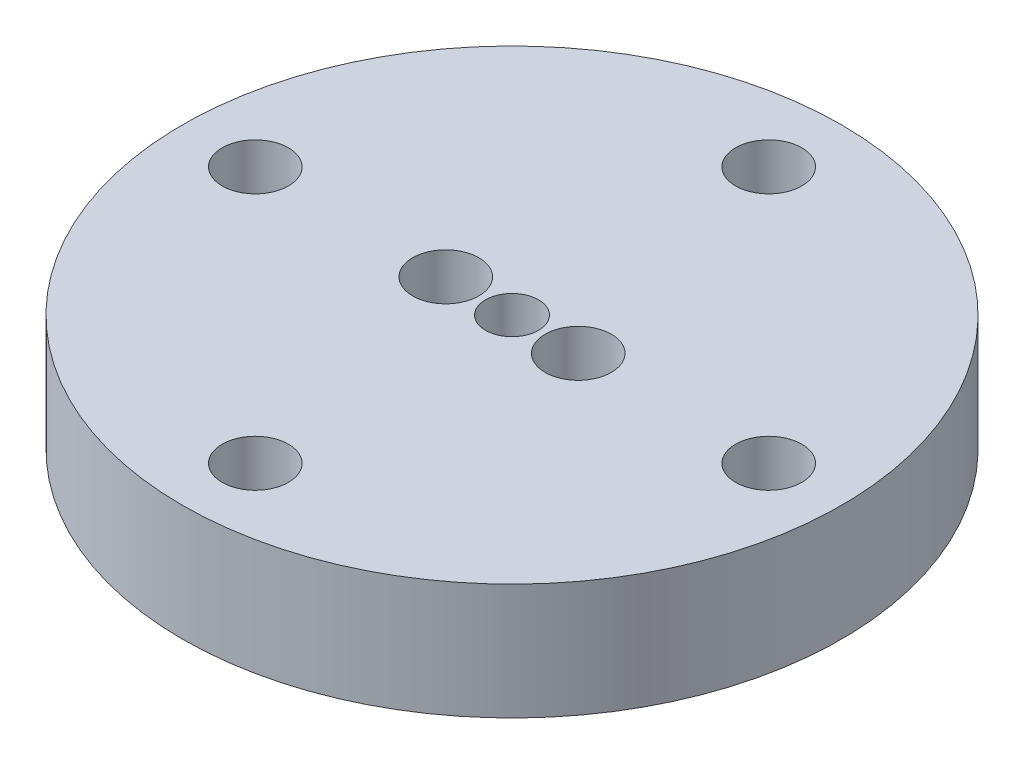
from build123d import *

# Parameters (mm, degrees)
SKETCH1_R           = 19.9
SKETCH1_R_2         = 2
SKETCH1_R_3         = 1.6
BOSS_EXTRUDE1_DEPTH = 7


with BuildPart() as part:
    # Sketch1 → Boss-Extrude1 (new body)
    with BuildSketch(Plane(origin=(0, 0, 0), x_dir=(1, 0, 0), z_dir=(0, 1, 0))):
        Circle(SKETCH1_R)
        with Locations((0, 15.5)):
            Circle(SKETCH1_R_2, mode=Mode.SUBTRACT)
        with Locations((15.5, 0)):
            Circle(SKETCH1_R_2, mode=Mode.SUBTRACT)
        with Locations((0, -15.5)):
            Circle(SKETCH1_R_2, mode=Mode.SUBTRACT)
        with Locations((-15.5, 0)):
            Circle(SKETCH1_R_2, mode=Mode.SUBTRACT)
        with Locations((-4, 0)):
            Circle(SKETCH1_R_2, mode=Mode.SUBTRACT)
        with Locations((4, 0)):
            Circle(SKETCH1_R_2, mode=Mode.SUBTRACT)
        Circle(SKETCH1_R_3, mode=Mode.SUBTRACT)
    extrude(amount=BOSS_EXTRUDE1_DEPTH)


solid = part.part
